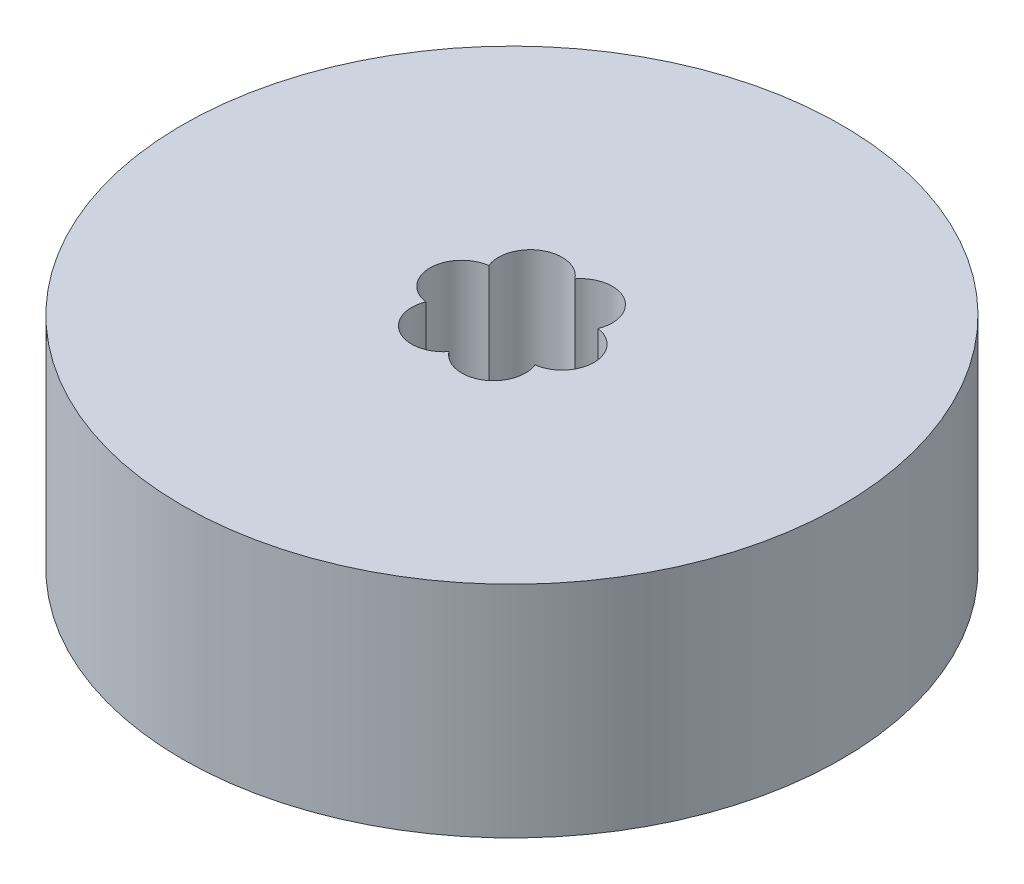
from build123d import *

# Parameters (mm, degrees)
SKETCH1_R           = 30
BOSS_EXTRUDE1_DEPTH = 20
SKETCH2_R           = 5
CUT_EXTRUDE1_DEPTH  = 47.904157598
SKETCH3_R           = 2.898603643
CUT_EXTRUDE2_DEPTH  = 13.937500009
CIRPATTERN1_COUNT   = 6


with BuildPart() as part:
    # Sketch1 → Boss-Extrude1 (new body)
    with BuildSketch(Plane(origin=(0, 0, 0), x_dir=(1, 0, 0), z_dir=(0, 1, 0))):
        Circle(SKETCH1_R)
    extrude(amount=BOSS_EXTRUDE1_DEPTH)

    # Sketch2 → Cut-Extrude1 (cut, through all)
    with BuildSketch(Plane(origin=(0, 0, 0), x_dir=(1, 0, 0), z_dir=(0, 1, 0))):
        Circle(SKETCH2_R)
    extrude(amount=CUT_EXTRUDE1_DEPTH, mode=Mode.SUBTRACT)

    # Sketch3 → Cut-Extrude2 (cut)
    with BuildSketch(Plane(origin=(0, 20, 0), x_dir=(1, 0, 0), z_dir=(0, 1, 0))):
        with Locations((-4.564381882, 0)):
            Circle(SKETCH3_R)
    cut_extrude2 = extrude(amount=-CUT_EXTRUDE2_DEPTH, mode=Mode.SUBTRACT)

    # CirPattern1: Cut-Extrude2 ×6 about axis
    cirpattern1_axis = Axis((0, 0, 0), (0, 1, 0))
    for i in range(1, CIRPATTERN1_COUNT):
        add(cut_extrude2.rotate(cirpattern1_axis, i * 360 / CIRPATTERN1_COUNT), mode=Mode.SUBTRACT)


solid = part.part
